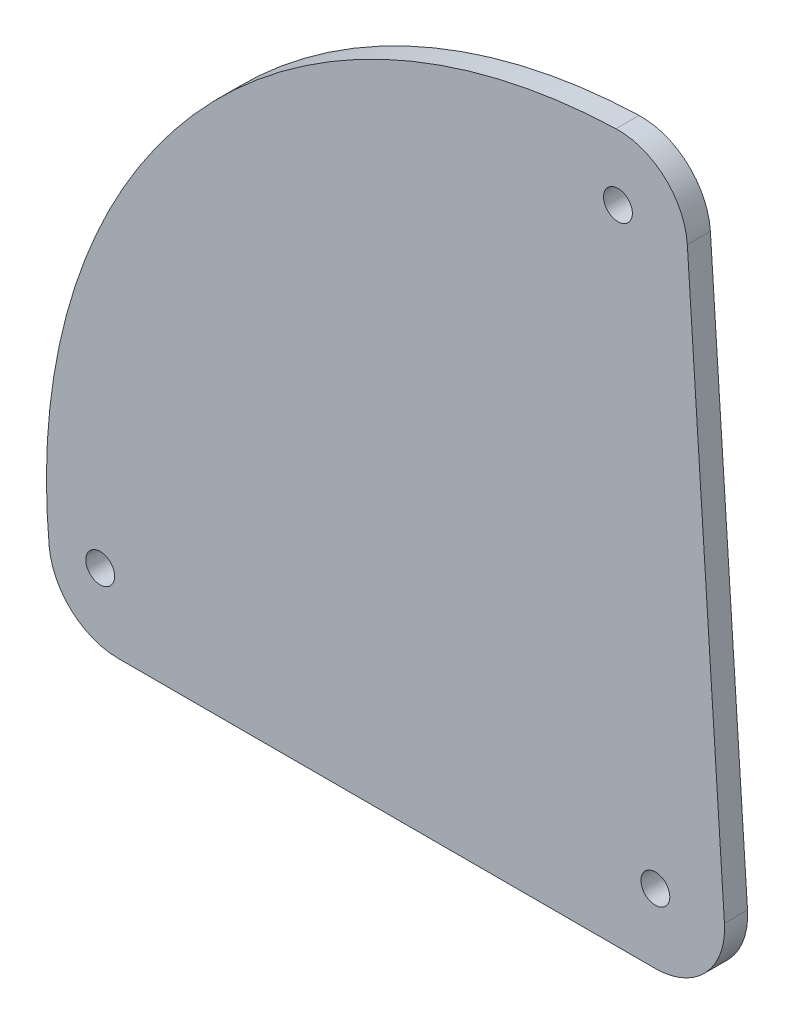
from build123d import *

# Parameters (mm, degrees)
SKETCH_1_R      = 3.125
EXTRUDE_1_DEPTH = 5
SCALE_1_SCALE   = 0.8


with BuildPart() as part:
    # 草图1 → 凸台-拉伸1 (new body)
    with BuildSketch(Plane.XY.offset(-18.206005243)):
        with BuildLine():
            Line((3.867902109, -69.618015729), (120.299999998, -69.618015729))
            ThreePointArc((120.299999998, -69.618015729), (131.246322711, -64.87364925), (135.268196544, -53.641751587))
            Line((135.268196544, -53.641751587), (127.222902207, 69.709644702))
            ThreePointArc((127.222902207, 69.709644702), (122.332732456, 79.843437948), (111.771655863, 83.725600612))
            ThreePointArc((111.771655863, 83.725600612), (20.072255788, 40.438021966), (-11.06192974, -56.06719515))
            ThreePointArc((-11.06192974, -56.06719515), (-6.21332571, -65.725168634), (3.867902109, -69.618015729))
        make_face()
        with Locations((120.299999998, -54.618015744)):
            Circle(SKETCH_1_R, mode=Mode.SUBTRACT)
        with Locations((112.197007482, 69.618015729)):
            Circle(SKETCH_1_R, mode=Mode.SUBTRACT)
        with Locations((0, -54.618015729)):
            Circle(SKETCH_1_R, mode=Mode.SUBTRACT)
    extrude(amount=-EXTRUDE_1_DEPTH)


with BuildPart() as part_1:
    # 缩放比例1: scaled about (67.864888422, -2.855235873, -20.706005243)
    add(part.part.scale(SCALE_1_SCALE).moved(Location((13.572977684, -0.571047175, -4.141201049))))


solid = part_1.part
